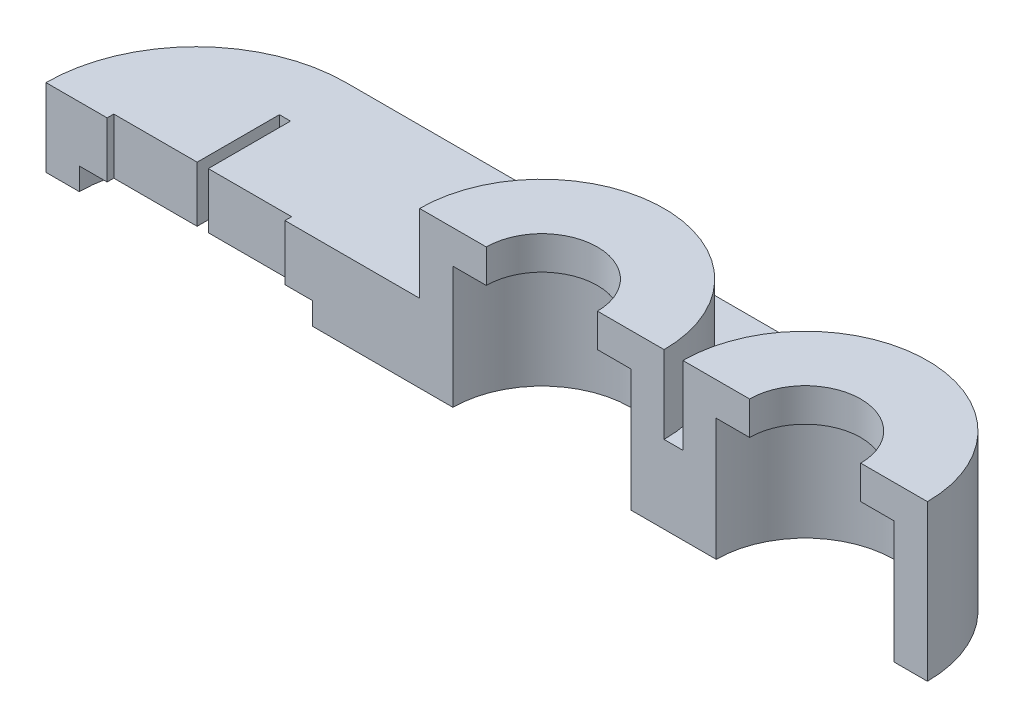
from build123d import *

# Parameters (mm, degrees)
SKETCH3_R               = 8
SKETCH3_R_2             = 5.000000000000001
BOSS_EXTRUDE1_DEPTH     = 7
CUT_EXTRUDE3_DEPTH      = 65.10592616131524
CUT_EXTRUDE3_DEPTH_BACK = 65.10592616131524
SKETCH4_R               = 1.7500000000000004
SKETCH4_R_2             = 1.7500000000000013
SKETCH6_R               = 10.999999999999993
SKETCH6_R_2             = 7.999999999999998
SKETCH6_R_3             = 11
SKETCH6_R_4             = 8
BOSS_EXTRUDE2_DEPTH     = 4
SKETCH7_R               = 10.999999999999993
SKETCH7_R_2             = 5.000000000000001
SKETCH7_R_3             = 11
SKETCH7_R_4             = 5
BOSS_EXTRUDE3_DEPTH     = 3
CHAMFER1_SIZE           = 2.5
CUT_EXTRUDE5_DEPTH      = 66.242392422412
CUT_EXTRUDE5_DEPTH_BACK = 66.242392422412
SKETCH9_R               = 1.7499999999999998
CUT_EXTRUDE6_START      = -2
SKETCH10_R              = 1.7499999999999998
CUT_EXTRUDE6_DEPTH      = 2
CHAMFER3_SIZE2          = 32
CHAMFER3_SIZE           = 22
CHAMFER4_SIZE           = 16
FILLET1_DEPTH           = 7
BOSS_EXTRUDE6_START     = 2
BOSS_EXTRUDE6_OUTLINE_R = 10.5
BOSS_EXTRUDE6_DEPTH     = 5
CUT_EXTRUDE7_DEPTH      = 66.24239242241201
CUT_EXTRUDE7_DEPTH_BACK = 66.24239242241201
SKETCH16_W              = 114.08603317988053
SKETCH16_H              = 61.14789556835377


with BuildPart() as part:
    # Sketch3 → Boss-Extrude1 (new body)
    # profile 1 of 10: a face of its own
    with BuildSketch(Plane(origin=(0, 0, 0), x_dir=(1, 0, 0), z_dir=(0, 1, 0))):
        with BuildLine():
            ThreePointArc((-17.613, 0), (-21.567058453981605, 9.545941546018392), (-31.113, 13.500000000000002))
            Line((-31.113, 13.5), (-31.113, 10.499999999999996))
            ThreePointArc((-31.11300000000032, 10.499999999999996), (-23.688378797541365, 7.424621202458859), (-20.613000000000003, 0))
            ThreePointArc((-20.613000000000003, -2.57e-15), (-23.688378797541368, -7.4246212024588605), (-31.11300000000031, -10.499999999999996))
            Line((-31.112999999999992, -10.499999999999996), (-31.112999999999992, -13.500000000000007))
            ThreePointArc((-31.11299999999999, -13.500000000000002), (-21.567058453981602, -9.545941546018385), (-17.613, -3.31e-15))
        make_face()
    # profile 2 of 10: a face of its own
    with BuildSketch(Plane(origin=(0, 0, 0), x_dir=(1, 0, 0), z_dir=(0, 1, 0))):
        with BuildLine():
            Line((-31.113, 10.499999999999996), (-31.113, 13.5))
            ThreePointArc((-31.113, 13.500000000000002), (-44.613, -4.34e-15), (-31.11299999999999, -13.500000000000002))
            Line((-31.112999999999992, -13.500000000000007), (-31.112999999999992, -10.499999999999996))
            ThreePointArc((-31.11300000000031, -10.499999999999996), (-41.613, -8.04e-15), (-31.11300000000032, 10.499999999999996))
        make_face()
    # profile 3 of 10: a face of its own
    with BuildSketch(Plane(origin=(0, 0, 0), x_dir=(1, 0, 0), z_dir=(0, 1, 0))):
        with BuildLine():
            Line((23.690000000000005, 13.500000000000002), (-31.113, 13.5))
            ThreePointArc((-31.113, 13.500000000000002), (-21.567058453981605, 9.545941546018392), (-17.613, 0))
            ThreePointArc((-17.613, -3.31e-15), (-21.567058453981602, -9.545941546018385), (-31.11299999999999, -13.500000000000002))
            Line((-31.112999999999992, -13.500000000000005), (23.690000000000005, -13.499999999999998))
            Line((23.690000000000005, -13.499999999999998), (23.690000000000005, -10.999999999999991))
            ThreePointArc((23.689999999999998, -10.999999999999993), (12.690000000000008, 1.112e-14), (23.690000000000015, 10.999999999999993))
            Line((23.690000000000005, 10.999999999999993), (23.690000000000005, 13.500000000000002))
        make_face()
        with Locations(Location((0, 0, 0), (0, 0, 270))):
            Circle(SKETCH3_R, mode=Mode.SUBTRACT)
    # profile 4 of 10: a face of its own
    with BuildSketch(Plane(origin=(0, 0, 0), x_dir=(1, 0, 0), z_dir=(0, 1, 0))):
        with BuildLine():
            ThreePointArc((-17.613, 0), (-21.567058453981605, 9.545941546018392), (-31.113, 13.500000000000002))
            Line((-31.113, 13.5), (-31.113, 10.499999999999996))
            ThreePointArc((-31.11300000000032, 10.499999999999996), (-23.688378797541365, 7.424621202458859), (-20.613000000000003, 0))
            ThreePointArc((-20.613000000000003, -2.57e-15), (-23.688378797541368, -7.4246212024588605), (-31.11300000000031, -10.499999999999996))
            Line((-31.112999999999992, -10.499999999999996), (-31.112999999999992, -13.500000000000007))
            ThreePointArc((-31.11299999999999, -13.500000000000002), (-21.567058453981602, -9.545941546018385), (-17.613, -3.31e-15))
        make_face()
    # profile 5 of 10: a face of its own
    with BuildSketch(Plane(origin=(0, 0, 0), x_dir=(1, 0, 0), z_dir=(0, 1, 0))):
        with BuildLine():
            Line((-31.113, 10.499999999999996), (-31.113, 13.5))
            ThreePointArc((-31.113, 13.500000000000002), (-44.613, -4.34e-15), (-31.11299999999999, -13.500000000000002))
            Line((-31.112999999999992, -13.500000000000007), (-31.112999999999992, -10.499999999999996))
            ThreePointArc((-31.11300000000031, -10.499999999999996), (-41.613, -8.04e-15), (-31.11300000000032, 10.499999999999996))
        make_face()
    # profile 6 of 10: a face of its own
    with BuildSketch(Plane(origin=(0, 0, 0), x_dir=(1, 0, 0), z_dir=(0, 1, 0))):
        with BuildLine():
            ThreePointArc((34.69, 0), (31.468174593052026, 7.778174593052012), (23.690000000000015, 10.999999999999993))
            Line((23.690000000000005, 10.999999999999993), (23.690000000000005, 7.999999999999998))
            ThreePointArc((23.689999999999863, 7.999999999999998), (29.34685424949233, 5.6568542494924285), (31.689999999999998, 0))
            ThreePointArc((31.689999999999998, -1.96e-15), (29.34685424949233, -5.65685424949243), (23.68999999999986, -7.999999999999998))
            Line((23.690000000000005, -7.999999999999998), (23.690000000000005, -10.999999999999991))
            ThreePointArc((23.689999999999998, -10.999999999999993), (31.468174593052016, -7.77817459305202), (34.69, -2.69e-15))
        make_face()
    # profile 7 of 10: a face of its own
    with BuildSketch(Plane(origin=(0, 0, 0), x_dir=(1, 0, 0), z_dir=(0, 1, 0))):
        with BuildLine():
            Line((23.690000000000005, 7.999999999999998), (23.690000000000005, 10.999999999999993))
            ThreePointArc((23.690000000000015, 10.999999999999993), (12.690000000000008, 1.112e-14), (23.689999999999998, -10.999999999999993))
            Line((23.690000000000005, -10.999999999999991), (23.690000000000005, -7.999999999999998))
            ThreePointArc((23.68999999999986, -7.999999999999998), (15.690000000000003, 9.8e-16), (23.689999999999863, 7.999999999999998))
        make_face()
    # profile 8 of 10: a face of its own
    with BuildSketch(Plane(origin=(0, 0, 0), x_dir=(1, 0, 0), z_dir=(0, 1, 0))):
        Polygon((-31.112999999999992, -13.500000000000005), (23.690000000000005, -13.499999999999998), (23.690000000000005, -45.5), (-31.11299999999999, -45.5), align=None)
        with Locations(Location((0, -32.70757493091458, 0), (0, 0, 270))):
            Circle(SKETCH3_R_2, mode=Mode.SUBTRACT)
    # profile 9 of 10: a face of its own
    with BuildSketch(Plane(origin=(0, 0, 0), x_dir=(1, 0, 0), z_dir=(0, 1, 0))):
        with BuildLine():
            ThreePointArc((34.69, 0), (31.468174593052026, 7.778174593052012), (23.690000000000015, 10.999999999999993))
            Line((23.690000000000005, 10.999999999999993), (23.690000000000005, 7.999999999999998))
            ThreePointArc((23.689999999999863, 7.999999999999998), (29.34685424949233, 5.6568542494924285), (31.689999999999998, 0))
            ThreePointArc((31.689999999999998, -1.96e-15), (29.34685424949233, -5.65685424949243), (23.68999999999986, -7.999999999999998))
            Line((23.690000000000005, -7.999999999999998), (23.690000000000005, -10.999999999999991))
            ThreePointArc((23.689999999999998, -10.999999999999993), (31.468174593052016, -7.77817459305202), (34.69, -2.69e-15))
        make_face()
    # profile 10 of 10: a face of its own
    with BuildSketch(Plane(origin=(0, 0, 0), x_dir=(1, 0, 0), z_dir=(0, 1, 0))):
        with BuildLine():
            Line((23.690000000000005, 7.999999999999998), (23.690000000000005, 10.999999999999993))
            ThreePointArc((23.690000000000015, 10.999999999999993), (12.690000000000008, 1.112e-14), (23.689999999999998, -10.999999999999993))
            Line((23.690000000000005, -10.999999999999991), (23.690000000000005, -7.999999999999998))
            ThreePointArc((23.68999999999986, -7.999999999999998), (15.690000000000003, 9.8e-16), (23.689999999999863, 7.999999999999998))
        make_face()
    extrude(amount=BOSS_EXTRUDE1_DEPTH)

    # Sketch4 → Cut-Extrude3 (cut, two sides: drawn at the far end of the back side and taken through both)
    with BuildSketch(Plane(origin=(0, 0, 0), x_dir=(1, 0, 0), z_dir=(0, 1, 0)).offset(-CUT_EXTRUDE3_DEPTH_BACK)):
        with Locations(Location((5.5, -27.207574930914586, 0), (0, 0, 270))):
            Circle(SKETCH4_R)
        with Locations(Location((5.5, -38.20757493091458, 0), (0, 0, 270))):
            Circle(SKETCH4_R_2)
        with Locations(Location((-5.5, -38.20757493091458, 0), (0, 0, 270))):
            Circle(SKETCH4_R_2)
        with Locations(Location((-5.5, -27.207574930914586, 0), (0, 0, 270))):
            Circle(SKETCH4_R)
    extrude(amount=CUT_EXTRUDE3_DEPTH + CUT_EXTRUDE3_DEPTH_BACK, mode=Mode.SUBTRACT)

    # Sketch6 → Boss-Extrude2 (add)
    # profile 1 of 2: a face of its own
    with BuildSketch(Plane(origin=(0, 7, 0), x_dir=(1, 0, 0), z_dir=(0, 1, 0))):
        with Locations(Location((23.69, 0, 0), (0, 0, 270))):
            Circle(SKETCH6_R)
        with Locations(Location((23.69, 0, 0), (0, 0, 270))):
            Circle(SKETCH6_R_2, mode=Mode.SUBTRACT)
    # profile 2 of 2: a face of its own
    with BuildSketch(Plane(origin=(0, 7, 0), x_dir=(1, 0, 0), z_dir=(0, 1, 0))):
        with Locations(Location((0, 0, 0), (0, 0, 270))):
            Circle(SKETCH6_R_3)
        with Locations(Location((0, 0, 0), (0, 0, 270))):
            Circle(SKETCH6_R_4, mode=Mode.SUBTRACT)
    extrude(amount=BOSS_EXTRUDE2_DEPTH)

    # Sketch7 → Boss-Extrude3 (add)
    # profile 1 of 2: a face of its own
    with BuildSketch(Plane(origin=(0, 11, 0), x_dir=(1, 0, 0), z_dir=(0, 1, 0))):
        with Locations(Location((23.69, 0, 0), (0, 0, 270))):
            Circle(SKETCH7_R)
        with Locations(Location((23.69, 0, 0), (0, 0, 270))):
            Circle(SKETCH7_R_2, mode=Mode.SUBTRACT)
    # profile 2 of 2: a face of its own
    with BuildSketch(Plane(origin=(0, 11, 0), x_dir=(1, 0, 0), z_dir=(0, 1, 0))):
        with Locations(Location((0, 0, 0), (0, 0, 270))):
            Circle(SKETCH7_R_3)
        with Locations(Location((0, 0, 0), (0, 0, 270))):
            Circle(SKETCH7_R_4, mode=Mode.SUBTRACT)
    extrude(amount=BOSS_EXTRUDE3_DEPTH)

    # Chamfer1
    # the kernel refuses this chamfer: 2.5 mm, written as the material it adds along each edge
    with BuildSketch(Plane(origin=(23.690000000000012, 0, -10.999999999999993), x_dir=(0.9912092295509807, 0, 0.13230367815352426), z_dir=(0, 1, 0))) as chamfer1_piece_1_section:
        with BuildLine():
            Line((2.910680919377515, 1e-17), (-CHAMFER1_SIZE * 0.132303678154, CHAMFER1_SIZE * 0.991209229551))
            Line((-CHAMFER1_SIZE * 0.132303678154, CHAMFER1_SIZE * 0.991209229551), (0, 0))
            ThreePointArc((0, 0), (1.4955265802521478, 0.09662506904492212), (2.910680919377515, 1e-17))
        make_face()
    chamfer1_piece_1 = extrude(amount=7, mode=Mode.PRIVATE)
    chamfer1_piece_1 = split(chamfer1_piece_1, bisect_by=Plane(origin=(23.690000000000012, 0, -13.500000000000002), z_dir=(3e-17, 0, 1)), keep=Keep.TOP, mode=Mode.PRIVATE)
    add(chamfer1_piece_1)

    # Sketch9 → Cut-Extrude5 (cut, two sides: drawn at the far end of the back side and taken through both)
    with BuildSketch(Plane(origin=(0, 0, 0), x_dir=(1, 0, 0), z_dir=(0, 1, 0)).offset(-CUT_EXTRUDE5_DEPTH_BACK)):
        with Locations(Location((12, 9, 0), (0, 0, 90))):
            Circle(SKETCH9_R)
        with Locations(Location((12, -9, 0), (0, 0, 90))):
            Circle(SKETCH9_R)
        with Locations(Location((-12, -9, 0), (0, 0, 90))):
            Circle(SKETCH9_R)
        with Locations(Location((-12, 9, 0), (0, 0, 90))):
            Circle(SKETCH9_R)
    extrude(amount=CUT_EXTRUDE5_DEPTH + CUT_EXTRUDE5_DEPTH_BACK, mode=Mode.SUBTRACT)

    # Sketch10 → Cut-Extrude6 (cut)
    # profile 1 of 4: a face of its own
    with BuildSketch(Plane(origin=(0, 7, 0), x_dir=(1, 0, 0), z_dir=(0, 1, 0)).offset(CUT_EXTRUDE6_START)):
        Polygon((-15.17542648054294, -9.000000000000002), (-13.587713240271471, -11.749999999999998), (-10.412286759728527, -11.749999999999998), (-8.824573519457056, -8.999999999999998), (-10.412286759728529, -6.249999999999998), (-13.58771324027147, -6.249999999999998), align=None)
        with Locations(Location((-12, -9, 0), (0, 0, 90))):
            Circle(SKETCH10_R, mode=Mode.SUBTRACT)
    # profile 2 of 4: a face of its own
    with BuildSketch(Plane(origin=(0, 7, 0), x_dir=(1, 0, 0), z_dir=(0, 1, 0)).offset(CUT_EXTRUDE6_START)):
        Polygon((-15.17542648054294, 8.999999999999998), (-13.587713240271473, 6.249999999999999), (-10.41228675972853, 6.249999999999999), (-8.824573519457058, 9), (-10.412286759728529, 11.75), (-13.587713240271468, 11.75), align=None)
        with Locations(Location((-12, 9, 0), (0, 0, 90))):
            Circle(SKETCH10_R, mode=Mode.SUBTRACT)
    # profile 3 of 4: a face of its own
    with BuildSketch(Plane(origin=(0, 7, 0), x_dir=(1, 0, 0), z_dir=(0, 1, 0)).offset(CUT_EXTRUDE6_START)):
        Polygon((15.175426480542939, 8.999999999999998), (13.587713240271471, 11.749999999999996), (10.412286759728532, 11.749999999999996), (8.82457351945706, 8.999999999999995), (10.412286759728527, 6.249999999999997), (13.58771324027147, 6.249999999999997), align=None)
        with Locations(Location((12, 9, 0), (0, 0, 90))):
            Circle(SKETCH10_R, mode=Mode.SUBTRACT)
    # profile 4 of 4: a face of its own
    with BuildSketch(Plane(origin=(0, 7, 0), x_dir=(1, 0, 0), z_dir=(0, 1, 0)).offset(CUT_EXTRUDE6_START)):
        Polygon((15.17542648054294, -9.000000000000002), (13.58771324027147, -6.249999999999999), (10.41228675972853, -6.249999999999999), (8.824573519457058, -9.000000000000002), (10.41228675972853, -11.75), (13.587713240271471, -11.75), align=None)
        with Locations(Location((12, -9, 0), (0, 0, 90))):
            Circle(SKETCH10_R, mode=Mode.SUBTRACT)
    extrude(amount=CUT_EXTRUDE6_DEPTH, mode=Mode.SUBTRACT)

    # Chamfer2
    # the kernel refuses this chamfer: 5 mm, written as the material it adds along each edge
    with BuildSketch(Plane(origin=(23.69, 0, 10.999999999999993), x_dir=(0.9874000606639179, 0, -0.15824386307497393), z_dir=(0, 1, 0))) as chamfer2_piece_1:
        with BuildLine():
            Line((3.622786343886572, 0.1414213562374673), (-0.8058373565311953, -4.287202344190177))
            Line((-0.8058373565311953, -4.287202344190177), (-0.9045773625975885, -4.27137795788268))
            ThreePointArc((-0.9045773625975885, -4.27137795788268), (-0.4437672242597131, -2.1370546546533555), (-0.0987400060663932, 0.01582438630749762))
            Line((-0.0987400060663932, 0.01582438630749762), (0.01582438630749734, 0.09874000606639144))
            ThreePointArc((0.01582438630749734, 0.09874000606639144), (1.8121079396960726, -0.03836531209673867), (3.6069619575790735, 0.24016136230385873))
            Line((3.6069619575790735, 0.24016136230385873), (3.622786343886572, 0.1414213562374673))
        make_face()
    extrude(amount=7)

    # Chamfer3
    chamfer3_edges = [part.edges().sort_by_distance(p)[0] for p in [
        (-31.11299999999999, 3.5, 45.5),
    ]]
    chamfer3_side = [part.faces().sort_by_distance(p)[0] for p in [
        (-30.672999999999988, 3.5, 45.5),
    ]]
    chamfer(chamfer3_edges, length=CHAMFER3_SIZE - 0.0001, length2=CHAMFER3_SIZE2 - 0.0001, reference=chamfer3_side[0])  # a hair under: the kernel refuses the full size

    # Chamfer4
    chamfer4_edges = [part.edges().sort_by_distance(p)[0] for p in [
        (23.690000000000005, 3.5, 45.5),
    ]]
    chamfer(chamfer4_edges, length=CHAMFER4_SIZE)

    # Fillet1: read off the stored shape, not the designer's step
    # Fillet1 outline → Fillet1 (add)
    with BuildSketch(Plane(origin=(0, 0, 0), x_dir=(1, 0, 0), z_dir=(0, 1, 0))):
        with BuildLine():
            ThreePointArc((-31.113, -13.5), (-32.547033058, -13.423619079), (-33.96483904, -13.19534062))
            ThreePointArc((-33.96483904, -13.19534062), (-31.199410591, -14.370304214), (-29.062482337, -16.482571146))
            Line((-29.062482337, -16.482571146), (-31.113, -13.5))
        make_face()
    extrude(amount=FILLET1_DEPTH)

    # Boss-Extrude6: read off the stored shape, not the designer's step
    # Boss-Extrude6 outline → Boss-Extrude6 (add)
    with BuildSketch(Plane(origin=(0, 0, 0), x_dir=(1, 0, 0), z_dir=(0, 1, 0)).offset(BOSS_EXTRUDE6_START)):
        with Locations((-31.113, 0)):
            Circle(BOSS_EXTRUDE6_OUTLINE_R)
        Polygon((-30.613, 8), (-30.613, 0.6), (-23.113, 0.6), (-23.113, -0.6), (-30.613, -0.6), (-30.613, -8), (-31.613, -8), (-31.613, -0.6), (-39.113, -0.6), (-39.113, 0.6), (-31.613, 0.6), (-31.613, 8), align=None, mode=Mode.SUBTRACT)
    extrude(amount=BOSS_EXTRUDE6_DEPTH)

    # Sketch16 → Cut-Extrude7 (cut, two sides: drawn at the far end of the back side and taken through both)
    with BuildSketch(Plane(origin=(0, 0, 0), x_dir=(1, 0, 0), z_dir=(0, 1, 0)).offset(-CUT_EXTRUDE7_DEPTH_BACK)):
        with Locations((4.584286452118391, -30.573947784176884)):
            Rectangle(SKETCH16_W, SKETCH16_H)
    extrude(amount=CUT_EXTRUDE7_DEPTH + CUT_EXTRUDE7_DEPTH_BACK, mode=Mode.SUBTRACT)


solid = part.part
